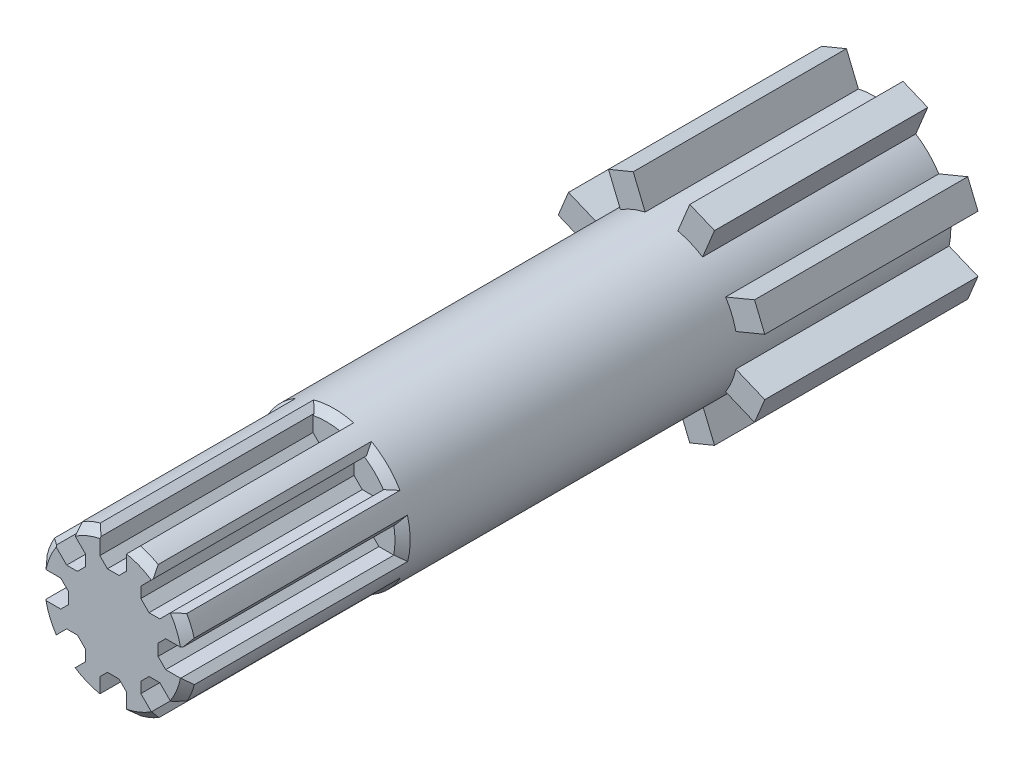
from build123d import *

# Parameters (mm, degrees)
SKETCH3_R           = 2.5
BOSS_EXTRUDE1_DEPTH = 25
BOSS_EXTRUDE2_DEPTH = 7
CUT_EXTRUDE1_START  = -7
CUT_EXTRUDE1_DEPTH  = 7
CHAMFER1_SIZE       = 0.25
CHAMFER2_SIZE       = 0.25
CHAMFER2_SIZE_2     = 0.215444776


with BuildPart() as part:
    # Sketch3 → Boss-Extrude1 (new body)
    with BuildSketch(Plane.XY):
        Circle(SKETCH3_R)
    extrude(amount=BOSS_EXTRUDE1_DEPTH)

    # Sketch2 → Boss-Extrude2 (add)
    with BuildSketch(Plane.XY):
        Polygon((1.741274388, 3.054032834), (1.128980896, 1.575825582), (0.315966908, 1.912587003), (0.928260399, 3.390794255), align=None)
        Polygon((3.390794255, 0.928260399), (1.912587003, 0.315966908), (1.575825582, 1.128980896), (3.054032834, 1.741274388), align=None)
        Polygon((3.054032834, -1.741274388), (1.575825582, -1.128980896), (1.912587003, -0.315966908), (3.390794255, -0.928260399), align=None)
        Polygon((0.928260399, -3.390794255), (0.315966908, -1.912587003), (1.128980896, -1.575825582), (1.741274388, -3.054032834), align=None)
        Polygon((-1.741274388, -3.054032834), (-1.128980896, -1.575825582), (-0.315966908, -1.912587003), (-0.928260399, -3.390794255), align=None)
        Polygon((-3.390794255, -0.928260399), (-1.912587003, -0.315966908), (-1.575825582, -1.128980896), (-3.054032834, -1.741274388), align=None)
        Polygon((-3.054032834, 1.741274388), (-1.575825582, 1.128980896), (-1.912587003, 0.315966908), (-3.390794255, 0.928260399), align=None)
        Polygon((-0.928260399, 3.390794255), (-0.315966908, 1.912587003), (-1.128980896, 1.575825582), (-1.741274388, 3.054032834), align=None)
    extrude(amount=BOSS_EXTRUDE2_DEPTH)

    # Sketch4 → Cut-Extrude1 (cut)
    with BuildSketch(Plane.XY.offset(25).offset(CUT_EXTRUDE1_START)):
        with BuildLine():
            Line((1.351900019, 0.729646051), (2.051299389, 1.429045422))
            ThreePointArc((2.051299389, 1.429045422), (1.767766953, 1.767766953), (1.429045422, 2.051299389))
            Line((1.429045422, 2.051299389), (0.729646051, 1.351900019))
            Line((0.729646051, 1.351900019), (1.351900019, 0.729646051))
        make_face()
        with BuildLine():
            Line((1.471875341, -0.44), (2.460975416, -0.44))
            ThreePointArc((2.460975416, -0.44), (2.5, 0), (2.460975416, 0.44))
            Line((2.460975416, 0.44), (1.471875341, 0.44))
            Line((1.471875341, 0.44), (1.471875341, -0.44))
        make_face()
        with BuildLine():
            Line((0.44, 1.471875341), (0.44, 2.460975416))
            ThreePointArc((0.44, 2.460975416), (0, 2.5), (-0.44, 2.460975416))
            Line((-0.44, 2.460975416), (-0.44, 1.471875341))
            Line((-0.44, 1.471875341), (0.44, 1.471875341))
        make_face()
        with BuildLine():
            Line((0.729646051, -1.351900019), (1.429045422, -2.051299389))
            ThreePointArc((1.429045422, -2.051299389), (1.767766953, -1.767766953), (2.051299389, -1.429045422))
            Line((2.051299389, -1.429045422), (1.351900019, -0.729646051))
            Line((1.351900019, -0.729646051), (0.729646051, -1.351900019))
        make_face()
        with BuildLine():
            Line((-0.44, -1.471875341), (-0.44, -2.460975416))
            ThreePointArc((-0.44, -2.460975416), (0, -2.5), (0.44, -2.460975416))
            Line((0.44, -2.460975416), (0.44, -1.471875341))
            Line((0.44, -1.471875341), (-0.44, -1.471875341))
        make_face()
        with BuildLine():
            Line((-1.351900019, -0.729646051), (-2.051299389, -1.429045422))
            ThreePointArc((-2.051299389, -1.429045422), (-1.767766953, -1.767766953), (-1.429045422, -2.051299389))
            Line((-1.429045422, -2.051299389), (-0.729646051, -1.351900019))
            Line((-0.729646051, -1.351900019), (-1.351900019, -0.729646051))
        make_face()
        with BuildLine():
            Line((-1.471875341, 0.44), (-2.460975416, 0.44))
            ThreePointArc((-2.460975416, 0.44), (-2.5, 0), (-2.460975416, -0.44))
            Line((-2.460975416, -0.44), (-1.471875341, -0.44))
            Line((-1.471875341, -0.44), (-1.471875341, 0.44))
        make_face()
        with BuildLine():
            Line((-0.729646051, 1.351900019), (-1.429045422, 2.051299389))
            ThreePointArc((-1.429045422, 2.051299389), (-1.767766953, 1.767766953), (-2.051299389, 1.429045422))
            Line((-2.051299389, 1.429045422), (-1.351900019, 0.729646051))
            Line((-1.351900019, 0.729646051), (-0.729646051, 1.351900019))
        make_face()
    extrude(amount=CUT_EXTRUDE1_DEPTH, mode=Mode.SUBTRACT)

    # Chamfer1
    chamfer1_edges = [part.edges().sort_by_distance(p)[0] for p in [
        (-0.729646051, 1.351900019, 21.5),
        (-1.351900019, 0.729646051, 21.5),
        (-1.471875341, 0.44, 21.5),
        (-1.471875341, -0.44, 21.5),
        (-1.351900019, -0.729646051, 21.5),
        (-0.729646051, -1.351900019, 21.5),
        (-0.44, -1.471875341, 21.5),
        (0.44, -1.471875341, 21.5),
        (0.729646051, -1.351900019, 21.5),
        (1.351900019, -0.729646051, 21.5),
        (1.471875341, -0.44, 21.5),
        (1.471875341, 0.44, 21.5),
        (1.351900019, 0.729646051, 21.5),
        (0.729646051, 1.351900019, 21.5),
        (0.44, 1.471875341, 21.5),
        (-0.44, 1.471875341, 21.5),
    ]]
    chamfer(chamfer1_edges, length=CHAMFER1_SIZE)

    # Chamfer2
    # the kernel refuses this chamfer: 0.25, 0.215444776 mm, written as the material it takes off along each edge
    with BuildSketch(Plane(origin=(0, 0, 25), x_dir=(0.7615184846341085, 0.6481431921732813, 0), z_dir=(0.6481431921732813, -0.7615184846341085, 0))) as chamfer2_piece_1:
        Polygon((2.5, -CHAMFER2_SIZE), (2.5 - CHAMFER2_SIZE, 0), (2.5, 0), align=None)
    revolve(axis=Axis((0, 0, 25), (0, 0, 1)), revolution_arc=54.196495253, mode=Mode.SUBTRACT)
    with BuildSketch(Plane(origin=(0, 0, 25), x_dir=(0.08016843811805723, 0.9967813308493048, 0), z_dir=(0.9967813308493048, -0.08016843811805723, 0))) as chamfer2_piece_2:
        Polygon((2.5, -CHAMFER2_SIZE), (2.5 - CHAMFER2_SIZE, 0), (2.5, 0), align=None)
    revolve(axis=Axis((0, 0, 25), (0, 0, 1)), revolution_arc=54.196495253, mode=Mode.SUBTRACT)
    with BuildSketch(Plane(origin=(0, 0, 25), x_dir=(-0.6481431921732823, 0.7615184846341077, 0), z_dir=(0.7615184846341077, 0.6481431921732823, 0))) as chamfer2_piece_3:
        Polygon((2.5, -CHAMFER2_SIZE), (2.5 - CHAMFER2_SIZE, 0), (2.5, 0), align=None)
    revolve(axis=Axis((0, 0, 25), (0, 0, 1)), revolution_arc=54.196495253, mode=Mode.SUBTRACT)
    with BuildSketch(Plane(origin=(0, 0, 25), x_dir=(-0.9967813308493041, 0.08016843811806748, 0), z_dir=(0.08016843811806748, 0.9967813308493041, 0))) as chamfer2_piece_4:
        Polygon((2.5, -CHAMFER2_SIZE), (2.5 - CHAMFER2_SIZE, 0), (2.5, 0), align=None)
    revolve(axis=Axis((0, 0, 25), (0, 0, 1)), revolution_arc=54.196495253, mode=Mode.SUBTRACT)
    with BuildSketch(Plane(origin=(0, 0, 25), x_dir=(-0.7615184846341134, -0.6481431921732754, 0), z_dir=(-0.6481431921732754, 0.7615184846341134, 0))) as chamfer2_piece_5:
        Polygon((2.5, -CHAMFER2_SIZE), (2.5 - CHAMFER2_SIZE, 0), (2.5, 0), align=None)
    revolve(axis=Axis((0, 0, 25), (0, 0, 1)), revolution_arc=54.196495253, mode=Mode.SUBTRACT)
    with BuildSketch(Plane(origin=(0, 0, 25), x_dir=(-0.08016843811806489, -0.9967813308493042, 0), z_dir=(-0.9967813308493042, 0.08016843811806489, 0))) as chamfer2_piece_6:
        Polygon((2.5, -CHAMFER2_SIZE), (2.5 - CHAMFER2_SIZE, 0), (2.5, 0), align=None)
    revolve(axis=Axis((0, 0, 25), (0, 0, 1)), revolution_arc=54.196495253, mode=Mode.SUBTRACT)
    with BuildSketch(Plane(origin=(0, 0, 25), x_dir=(0.6481431921732781, -0.7615184846341112, 0), z_dir=(-0.7615184846341112, -0.6481431921732781, 0))) as chamfer2_piece_7:
        Polygon((2.5, -CHAMFER2_SIZE), (2.5 - CHAMFER2_SIZE, 0), (2.5, 0), align=None)
    revolve(axis=Axis((0, 0, 25), (0, 0, 1)), revolution_arc=54.196495253, mode=Mode.SUBTRACT)
    with BuildSketch(Plane(origin=(0, 0, 18), x_dir=(-0.34412160352675203, 0.938925088591298, 0), z_dir=(0.938925088591298, 0.34412160352675203, 0))) as chamfer2_piece_8_section:
        Polygon((2.5, -CHAMFER2_SIZE), (2.5 - CHAMFER2_SIZE, 0), (2.5, 0), align=None)
    chamfer2_piece_8 = revolve(axis=Axis((0, 0, 18), (0, 0, 1)), revolution_arc=49.743631183, mode=Mode.PRIVATE)
    chamfer2_piece_8 = split(chamfer2_piece_8, bisect_by=Plane(origin=(-0.311126984, -0.311126984, 18), z_dir=(0.7071067811865451, 0.7071067811865499, 0)), keep=Keep.TOP, mode=Mode.PRIVATE)
    chamfer2_piece_8 = split(chamfer2_piece_8, bisect_by=Plane(origin=(0.311126984, 0.311126984, 18), z_dir=(-0.7071067811865446, -0.7071067811865505, 0)), keep=Keep.TOP, mode=Mode.PRIVATE)
    add(chamfer2_piece_8, mode=Mode.SUBTRACT)
    with BuildSketch(Plane(origin=(-2.051299389, 1.429045422, 18), x_dir=(-0.5317673689079134, -0.8468904683397701, 0), z_dir=(0, 0, 1)), Plane(origin=(-2.460975416, -0.44, 18), x_dir=(0.22282568051677323, -0.97485830565382, 0), z_dir=(0, 0, 1)), Plane(origin=(-1.429045422, -2.051299389, 18), x_dir=(0.8468904683397623, -0.5317673689079256, 0), z_dir=(0, 0, 1)), Plane(origin=(0.44, -2.460975416, 18), x_dir=(0.9748583056538195, 0.22282568051677598, 0), z_dir=(0, 0, 1)), Plane(origin=(2.051299389, -1.429045422, 18), x_dir=(0.5317673689079216, 0.8468904683397649, 0), z_dir=(0, 0, 1)), Plane(origin=(1.429045422, 2.051299389, 18), x_dir=(-0.8468904683397676, 0.5317673689079173, 0), z_dir=(0, 0, 1)), Plane(origin=(-0.44, 2.460975416, 18), x_dir=(-0.9748583056538175, -0.22282568051678414, 0), z_dir=(0, 0, 1))) as chamfer2_piece_9:
        with BuildLine():
            Line((0.238861735, 0), (CHAMFER2_SIZE_2 * 0.222825680958, CHAMFER2_SIZE_2 * 0.974858307584))
            Line((CHAMFER2_SIZE_2 * 0.222825680958, CHAMFER2_SIZE_2 * 0.974858307584), (0, 0))
            ThreePointArc((0, 0), (0.122792323, -0.002852116), (0.238861735, 0))
        make_face()
    extrude(amount=7.614246036, mode=Mode.SUBTRACT)
    with BuildSketch(Plane(origin=(-1.429045422, 2.051299389, 18), x_dir=(0.8437513575613513, 0.5367342420727197, 0), z_dir=(0, 0, 1)), Plane(origin=(-2.460975416, 0.44, 18), x_dir=(0.21709388430235488, 0.9761507288316266, 0), z_dir=(0, 0, 1)), Plane(origin=(-2.051299389, -1.429045422, 18), x_dir=(-0.5367342420727129, 0.8437513575613556, 0), z_dir=(0, 0, 1)), Plane(origin=(-0.44, -2.460975416, 18), x_dir=(-0.976150728831628, 0.21709388430234888, 0), z_dir=(0, 0, 1)), Plane(origin=(1.429045422, -2.051299389, 18), x_dir=(-0.8437513575613538, -0.5367342420727156, 0), z_dir=(0, 0, 1)), Plane(origin=(2.460975416, -0.44, 18), x_dir=(-0.2170938843023468, -0.9761507288316283, 0), z_dir=(0, 0, 1)), Plane(origin=(2.051299389, 1.429045422, 18), x_dir=(0.5367342420727192, -0.8437513575613516, 0), z_dir=(0, 0, 1)), Plane(origin=(0.44, 2.460975416, 18), x_dir=(0.9761507288316289, -0.2170938843023443, 0), z_dir=(0, 0, 1))) as chamfer2_piece_10:
        with BuildLine():
            Line((0.209512783, 0), (CHAMFER2_SIZE * 0.217093884302, -CHAMFER2_SIZE * 0.976150728832))
            Line((CHAMFER2_SIZE * 0.217093884302, -CHAMFER2_SIZE * 0.976150728832), (0, 0))
            ThreePointArc((0, 0), (0.107437891, 0.002194306), (0.209512783, 0))
        make_face()
    extrude(amount=7.642920747, mode=Mode.SUBTRACT)
    with BuildSketch(Plane(origin=(0, 0, 18), x_dir=(-0.9072510165756378, 0.42058957776254, 0), z_dir=(0.42058957776254, 0.9072510165756378, 0))) as chamfer2_piece_11_section:
        Polygon((2.5, -CHAMFER2_SIZE), (2.5 - CHAMFER2_SIZE, 0), (2.5, 0), align=None)
    chamfer2_piece_11 = revolve(axis=Axis((0, 0, 18), (0, 0, 1)), revolution_arc=49.743631183, mode=Mode.PRIVATE)
    chamfer2_piece_11 = split(chamfer2_piece_11, bisect_by=Plane(origin=(0, -0.44, 18), z_dir=(0, 1, 0)), keep=Keep.TOP, mode=Mode.PRIVATE)
    chamfer2_piece_11 = split(chamfer2_piece_11, bisect_by=Plane(origin=(0, 0.44, 18), z_dir=(0, -1, 0)), keep=Keep.TOP, mode=Mode.PRIVATE)
    add(chamfer2_piece_11, mode=Mode.SUBTRACT)
    with BuildSketch(Plane(origin=(0, 0, 18), x_dir=(-0.9389250885913029, -0.34412160352673893, 0), z_dir=(-0.34412160352673893, 0.9389250885913029, 0))) as chamfer2_piece_12_section:
        Polygon((2.5, -CHAMFER2_SIZE), (2.5 - CHAMFER2_SIZE, 0), (2.5, 0), align=None)
    chamfer2_piece_12 = revolve(axis=Axis((0, 0, 18), (0, 0, 1)), revolution_arc=49.743631183, mode=Mode.PRIVATE)
    chamfer2_piece_12 = split(chamfer2_piece_12, bisect_by=Plane(origin=(0.311126984, -0.311126984, 18), z_dir=(-0.7071067811865349, 0.7071067811865602, 0)), keep=Keep.TOP, mode=Mode.PRIVATE)
    chamfer2_piece_12 = split(chamfer2_piece_12, bisect_by=Plane(origin=(-0.311126984, 0.311126984, 18), z_dir=(0.7071067811865352, -0.7071067811865598, 0)), keep=Keep.TOP, mode=Mode.PRIVATE)
    add(chamfer2_piece_12, mode=Mode.SUBTRACT)
    with BuildSketch(Plane(origin=(0, 0, 18), x_dir=(-0.42058957776253453, -0.9072510165756403, 0), z_dir=(-0.9072510165756403, 0.42058957776253453, 0))) as chamfer2_piece_13_section:
        Polygon((2.5, -CHAMFER2_SIZE), (2.5 - CHAMFER2_SIZE, 0), (2.5, 0), align=None)
    chamfer2_piece_13 = revolve(axis=Axis((0, 0, 18), (0, 0, 1)), revolution_arc=49.743631183, mode=Mode.PRIVATE)
    chamfer2_piece_13 = split(chamfer2_piece_13, bisect_by=Plane(origin=(0.44, 0, 18), z_dir=(-1, 0, 0)), keep=Keep.TOP, mode=Mode.PRIVATE)
    chamfer2_piece_13 = split(chamfer2_piece_13, bisect_by=Plane(origin=(-0.44, 0, 18), z_dir=(1, 0, 0)), keep=Keep.TOP, mode=Mode.PRIVATE)
    add(chamfer2_piece_13, mode=Mode.SUBTRACT)
    with BuildSketch(Plane(origin=(0, 0, 18), x_dir=(0.3441216035267472, -0.9389250885912998, 0), z_dir=(-0.9389250885912998, -0.3441216035267472, 0))) as chamfer2_piece_14_section:
        Polygon((2.5, -CHAMFER2_SIZE), (2.5 - CHAMFER2_SIZE, 0), (2.5, 0), align=None)
    chamfer2_piece_14 = revolve(axis=Axis((0, 0, 18), (0, 0, 1)), revolution_arc=49.743631183, mode=Mode.PRIVATE)
    chamfer2_piece_14 = split(chamfer2_piece_14, bisect_by=Plane(origin=(0.311126984, 0.311126984, 18), z_dir=(-0.7071067811865541, -0.707106781186541, 0)), keep=Keep.TOP, mode=Mode.PRIVATE)
    chamfer2_piece_14 = split(chamfer2_piece_14, bisect_by=Plane(origin=(-0.311126984, -0.311126984, 18), z_dir=(0.7071067811865537, 0.7071067811865414, 0)), keep=Keep.TOP, mode=Mode.PRIVATE)
    add(chamfer2_piece_14, mode=Mode.SUBTRACT)
    with BuildSketch(Plane(origin=(0, 0, 18), x_dir=(0.9072526697295138, -0.4205860117368026, 0), z_dir=(-0.4205860117368026, -0.9072526697295138, 0))) as chamfer2_piece_15_section:
        Polygon((2.5 - CHAMFER2_SIZE, 0), (2.5, -CHAMFER2_SIZE), (2.5, 0), align=None)
    chamfer2_piece_15 = revolve(axis=Axis((0, 0, 18), (0, 0, 1)), revolution_arc=24.871590386, mode=Mode.PRIVATE)
    chamfer2_piece_15 = split(chamfer2_piece_15, bisect_by=Plane(origin=(0, -0.44, 18), z_dir=(0, 1, 0)), keep=Keep.TOP, mode=Mode.PRIVATE)
    add(chamfer2_piece_15, mode=Mode.SUBTRACT)
    with BuildSketch(Plane(origin=(2.460975416, 0.44, 18), x_dir=(-1, 0, 0), z_dir=(0, 0, 1))) as chamfer2_piece_16:
        with BuildLine():
            Line((CHAMFER2_SIZE_2 * 1.00000000198, 0), (0.053224529, -0.232856346))
            ThreePointArc((0.053224529, -0.232856346), (0.024580874, -0.120340641), (0, 0))
            Line((0, 0), (CHAMFER2_SIZE_2 * 1.00000000198, 0))
        make_face()
    extrude(amount=7.614246036, mode=Mode.SUBTRACT)
    with BuildSketch(Plane(origin=(0, 0, 18), x_dir=(0.9389250885912971, 0.34412160352675497, 0), z_dir=(0.34412160352675497, -0.9389250885912971, 0))) as chamfer2_piece_17_section:
        Polygon((2.5, -CHAMFER2_SIZE), (2.5 - CHAMFER2_SIZE, 0), (2.5, 0), align=None)
    chamfer2_piece_17 = revolve(axis=Axis((0, 0, 18), (0, 0, 1)), revolution_arc=49.743631183, mode=Mode.PRIVATE)
    chamfer2_piece_17 = split(chamfer2_piece_17, bisect_by=Plane(origin=(-0.311126984, 0.311126984, 18), z_dir=(0.7071067811865476, -0.7071067811865475, 0)), keep=Keep.TOP, mode=Mode.PRIVATE)
    chamfer2_piece_17 = split(chamfer2_piece_17, bisect_by=Plane(origin=(0.311126984, -0.311126984, 18), z_dir=(-0.7071067811865478, 0.7071067811865474, 0)), keep=Keep.TOP, mode=Mode.PRIVATE)
    add(chamfer2_piece_17, mode=Mode.SUBTRACT)
    with BuildSketch(Plane(origin=(0, 0, 18), x_dir=(0.4205895777625337, 0.9072510165756408, 0), z_dir=(0.9072510165756408, -0.4205895777625337, 0))) as chamfer2_piece_18_section:
        Polygon((2.5, -CHAMFER2_SIZE), (2.5 - CHAMFER2_SIZE, 0), (2.5, 0), align=None)
    chamfer2_piece_18 = revolve(axis=Axis((0, 0, 18), (0, 0, 1)), revolution_arc=49.743631183, mode=Mode.PRIVATE)
    chamfer2_piece_18 = split(chamfer2_piece_18, bisect_by=Plane(origin=(-0.44, 0, 18), z_dir=(1, 0, 0)), keep=Keep.TOP, mode=Mode.PRIVATE)
    chamfer2_piece_18 = split(chamfer2_piece_18, bisect_by=Plane(origin=(0.44, 0, 18), z_dir=(-1, 0, 0)), keep=Keep.TOP, mode=Mode.PRIVATE)
    add(chamfer2_piece_18, mode=Mode.SUBTRACT)
    with BuildSketch(Plane(origin=(0, 0, 25), x_dir=(0.9967813308493045, -0.08016843811806099, 0), z_dir=(-0.08016843811806099, -0.9967813308493045, 0))) as chamfer2_piece_19:
        Polygon((2.5, -CHAMFER2_SIZE), (2.5 - CHAMFER2_SIZE, 0), (2.5, 0), align=None)
    revolve(axis=Axis((0, 0, 25), (0, 0, 1)), revolution_arc=54.196495253, mode=Mode.SUBTRACT)
    with BuildSketch(Plane(origin=(0, 0, 18), x_dir=(1, 0, 0), z_dir=(0, -1, 0))) as chamfer2_piece_20_section:
        Polygon((2.5 - CHAMFER2_SIZE, 0), (2.5, -CHAMFER2_SIZE), (2.5, 0), align=None)
    chamfer2_piece_20 = revolve(axis=Axis((0, 0, 18), (0, 0, 1)), revolution_arc=24.871590386, mode=Mode.PRIVATE)
    chamfer2_piece_20 = split(chamfer2_piece_20, bisect_by=Plane(origin=(0, 0.44, 18), z_dir=(0, -1, 0)), keep=Keep.TOP, mode=Mode.PRIVATE)
    add(chamfer2_piece_20, mode=Mode.SUBTRACT)
    with BuildSketch(Plane(origin=(0, 0, 18), x_dir=(-0.34412160352675203, 0.938925088591298, 0), z_dir=(0.938925088591298, 0.34412160352675203, 0))) as chamfer2_piece_21a_section:
        Polygon((2.5, -CHAMFER2_SIZE), (2.5 - CHAMFER2_SIZE, 0), (2.5, 0), align=None)
    chamfer2_piece_21a = revolve(axis=Axis((0, 0, 18), (0, 0, 1)), revolution_arc=49.743631183, mode=Mode.PRIVATE)
    chamfer2_piece_21a = split(chamfer2_piece_21a, bisect_by=Plane(origin=(0.311126984, 0.311126984, 18), z_dir=(0.7071067811865446, 0.7071067811865505, 0)), keep=Keep.TOP, mode=Mode.PRIVATE)
    with BuildSketch(Plane(origin=(-1.429045422, 2.051299389, 17.357079253), x_dir=(0.8437513575613513, 0.5367342420727197, 0), z_dir=(0, 0, 1))) as chamfer2_piece_21b_section:
        with BuildLine():
            Line((0.209512783, 0), (CHAMFER2_SIZE * 0.217093884302, -CHAMFER2_SIZE * 0.976150728832))
            Line((CHAMFER2_SIZE * 0.217093884302, -CHAMFER2_SIZE * 0.976150728832), (0, 0))
            ThreePointArc((0, 0), (0.107437891, 0.002194306), (0.209512783, 0))
        make_face()
    chamfer2_piece_21b = extrude(amount=7.642920747, mode=Mode.PRIVATE)
    chamfer2_piece_21b = split(chamfer2_piece_21b, bisect_by=Plane(origin=(-1.429045422, 2.051299389, 18), z_dir=(0, 0, -1)), keep=Keep.TOP, mode=Mode.PRIVATE)
    chamfer2_piece_21 = chamfer2_piece_21a & chamfer2_piece_21b
    add(chamfer2_piece_21, mode=Mode.SUBTRACT)
    with BuildSketch(Plane(origin=(-2.051299389, 1.429045422, 17.385753964), x_dir=(-0.5317673689079134, -0.8468904683397701, 0), z_dir=(0, 0, 1))) as chamfer2_piece_22a_section:
        with BuildLine():
            Line((0.238861735, 0), (CHAMFER2_SIZE_2 * 0.222825680958, CHAMFER2_SIZE_2 * 0.974858307584))
            Line((CHAMFER2_SIZE_2 * 0.222825680958, CHAMFER2_SIZE_2 * 0.974858307584), (0, 0))
            ThreePointArc((0, 0), (0.122792323, -0.002852116), (0.238861735, 0))
        make_face()
    chamfer2_piece_22a = extrude(amount=7.614246036, mode=Mode.PRIVATE)
    chamfer2_piece_22a = split(chamfer2_piece_22a, bisect_by=Plane(origin=(-2.051299389, 1.429045422, 18), z_dir=(0, 0, -1)), keep=Keep.TOP, mode=Mode.PRIVATE)
    with BuildSketch(Plane(origin=(0, 0, 18), x_dir=(-0.34412160352675203, 0.938925088591298, 0), z_dir=(0.938925088591298, 0.34412160352675203, 0))) as chamfer2_piece_22b_section:
        Polygon((2.5, -CHAMFER2_SIZE), (2.5 - CHAMFER2_SIZE, 0), (2.5, 0), align=None)
    chamfer2_piece_22b = revolve(axis=Axis((0, 0, 18), (0, 0, 1)), revolution_arc=49.743631183, mode=Mode.PRIVATE)
    chamfer2_piece_22b = split(chamfer2_piece_22b, bisect_by=Plane(origin=(-0.311126984, -0.311126984, 18), z_dir=(-0.7071067811865451, -0.7071067811865499, 0)), keep=Keep.TOP, mode=Mode.PRIVATE)
    chamfer2_piece_22 = chamfer2_piece_22a & chamfer2_piece_22b
    add(chamfer2_piece_22, mode=Mode.SUBTRACT)
    with BuildSketch(Plane(origin=(0, 0, 18), x_dir=(-0.9072510165756378, 0.42058957776254, 0), z_dir=(0.42058957776254, 0.9072510165756378, 0))) as chamfer2_piece_23a_section:
        Polygon((2.5, -CHAMFER2_SIZE), (2.5 - CHAMFER2_SIZE, 0), (2.5, 0), align=None)
    chamfer2_piece_23a = revolve(axis=Axis((0, 0, 18), (0, 0, 1)), revolution_arc=49.743631183, mode=Mode.PRIVATE)
    chamfer2_piece_23a = split(chamfer2_piece_23a, bisect_by=Plane(origin=(0, 0.44, 18), z_dir=(0, 1, 0)), keep=Keep.TOP, mode=Mode.PRIVATE)
    with BuildSketch(Plane(origin=(-2.460975416, 0.44, 17.357079253), x_dir=(0.21709388430235488, 0.9761507288316266, 0), z_dir=(0, 0, 1))) as chamfer2_piece_23b_section:
        with BuildLine():
            Line((0.209512783, 0), (CHAMFER2_SIZE * 0.217093884302, -CHAMFER2_SIZE * 0.976150728832))
            Line((CHAMFER2_SIZE * 0.217093884302, -CHAMFER2_SIZE * 0.976150728832), (0, 0))
            ThreePointArc((0, 0), (0.107437891, 0.002194306), (0.209512783, 0))
        make_face()
    chamfer2_piece_23b = extrude(amount=7.642920747, mode=Mode.PRIVATE)
    chamfer2_piece_23b = split(chamfer2_piece_23b, bisect_by=Plane(origin=(-2.460975416, 0.44, 18), z_dir=(0, 0, -1)), keep=Keep.TOP, mode=Mode.PRIVATE)
    chamfer2_piece_23 = chamfer2_piece_23a & chamfer2_piece_23b
    add(chamfer2_piece_23, mode=Mode.SUBTRACT)
    with BuildSketch(Plane(origin=(-2.460975416, -0.44, 17.385753964), x_dir=(0.22282568051677323, -0.97485830565382, 0), z_dir=(0, 0, 1))) as chamfer2_piece_24a_section:
        with BuildLine():
            Line((0.238861735, 0), (CHAMFER2_SIZE_2 * 0.222825680958, CHAMFER2_SIZE_2 * 0.974858307584))
            Line((CHAMFER2_SIZE_2 * 0.222825680958, CHAMFER2_SIZE_2 * 0.974858307584), (0, 0))
            ThreePointArc((0, 0), (0.122792323, -0.002852116), (0.238861735, 0))
        make_face()
    chamfer2_piece_24a = extrude(amount=7.614246036, mode=Mode.PRIVATE)
    chamfer2_piece_24a = split(chamfer2_piece_24a, bisect_by=Plane(origin=(-2.460975416, -0.44, 18), z_dir=(0, 0, -1)), keep=Keep.TOP, mode=Mode.PRIVATE)
    with BuildSketch(Plane(origin=(0, 0, 18), x_dir=(-0.9072510165756378, 0.42058957776254, 0), z_dir=(0.42058957776254, 0.9072510165756378, 0))) as chamfer2_piece_24b_section:
        Polygon((2.5, -CHAMFER2_SIZE), (2.5 - CHAMFER2_SIZE, 0), (2.5, 0), align=None)
    chamfer2_piece_24b = revolve(axis=Axis((0, 0, 18), (0, 0, 1)), revolution_arc=49.743631183, mode=Mode.PRIVATE)
    chamfer2_piece_24b = split(chamfer2_piece_24b, bisect_by=Plane(origin=(0, -0.44, 18), z_dir=(0, -1, 0)), keep=Keep.TOP, mode=Mode.PRIVATE)
    chamfer2_piece_24 = chamfer2_piece_24a & chamfer2_piece_24b
    add(chamfer2_piece_24, mode=Mode.SUBTRACT)
    with BuildSketch(Plane(origin=(0, 0, 18), x_dir=(-0.9389250885913029, -0.34412160352673893, 0), z_dir=(-0.34412160352673893, 0.9389250885913029, 0))) as chamfer2_piece_25a_section:
        Polygon((2.5, -CHAMFER2_SIZE), (2.5 - CHAMFER2_SIZE, 0), (2.5, 0), align=None)
    chamfer2_piece_25a = revolve(axis=Axis((0, 0, 18), (0, 0, 1)), revolution_arc=49.743631183, mode=Mode.PRIVATE)
    chamfer2_piece_25a = split(chamfer2_piece_25a, bisect_by=Plane(origin=(-0.311126984, 0.311126984, 18), z_dir=(-0.7071067811865352, 0.7071067811865598, 0)), keep=Keep.TOP, mode=Mode.PRIVATE)
    with BuildSketch(Plane(origin=(-2.051299389, -1.429045422, 17.357079253), x_dir=(-0.5367342420727129, 0.8437513575613556, 0), z_dir=(0, 0, 1))) as chamfer2_piece_25b_section:
        with BuildLine():
            Line((0.209512783, 0), (CHAMFER2_SIZE * 0.217093884302, -CHAMFER2_SIZE * 0.976150728832))
            Line((CHAMFER2_SIZE * 0.217093884302, -CHAMFER2_SIZE * 0.976150728832), (0, 0))
            ThreePointArc((0, 0), (0.107437891, 0.002194306), (0.209512783, 0))
        make_face()
    chamfer2_piece_25b = extrude(amount=7.642920747, mode=Mode.PRIVATE)
    chamfer2_piece_25b = split(chamfer2_piece_25b, bisect_by=Plane(origin=(-2.051299389, -1.429045422, 18), z_dir=(0, 0, -1)), keep=Keep.TOP, mode=Mode.PRIVATE)
    chamfer2_piece_25 = chamfer2_piece_25a & chamfer2_piece_25b
    add(chamfer2_piece_25, mode=Mode.SUBTRACT)
    with BuildSketch(Plane(origin=(-1.429045422, -2.051299389, 17.385753964), x_dir=(0.8468904683397623, -0.5317673689079256, 0), z_dir=(0, 0, 1))) as chamfer2_piece_26a_section:
        with BuildLine():
            Line((0.238861735, 0), (CHAMFER2_SIZE_2 * 0.222825680958, CHAMFER2_SIZE_2 * 0.974858307584))
            Line((CHAMFER2_SIZE_2 * 0.222825680958, CHAMFER2_SIZE_2 * 0.974858307584), (0, 0))
            ThreePointArc((0, 0), (0.122792323, -0.002852116), (0.238861735, 0))
        make_face()
    chamfer2_piece_26a = extrude(amount=7.614246036, mode=Mode.PRIVATE)
    chamfer2_piece_26a = split(chamfer2_piece_26a, bisect_by=Plane(origin=(-1.429045422, -2.051299389, 18), z_dir=(0, 0, -1)), keep=Keep.TOP, mode=Mode.PRIVATE)
    with BuildSketch(Plane(origin=(0, 0, 18), x_dir=(-0.9389250885913029, -0.34412160352673893, 0), z_dir=(-0.34412160352673893, 0.9389250885913029, 0))) as chamfer2_piece_26b_section:
        Polygon((2.5, -CHAMFER2_SIZE), (2.5 - CHAMFER2_SIZE, 0), (2.5, 0), align=None)
    chamfer2_piece_26b = revolve(axis=Axis((0, 0, 18), (0, 0, 1)), revolution_arc=49.743631183, mode=Mode.PRIVATE)
    chamfer2_piece_26b = split(chamfer2_piece_26b, bisect_by=Plane(origin=(0.311126984, -0.311126984, 18), z_dir=(0.7071067811865349, -0.7071067811865602, 0)), keep=Keep.TOP, mode=Mode.PRIVATE)
    chamfer2_piece_26 = chamfer2_piece_26a & chamfer2_piece_26b
    add(chamfer2_piece_26, mode=Mode.SUBTRACT)
    with BuildSketch(Plane(origin=(0, 0, 18), x_dir=(-0.42058957776253453, -0.9072510165756403, 0), z_dir=(-0.9072510165756403, 0.42058957776253453, 0))) as chamfer2_piece_27a_section:
        Polygon((2.5, -CHAMFER2_SIZE), (2.5 - CHAMFER2_SIZE, 0), (2.5, 0), align=None)
    chamfer2_piece_27a = revolve(axis=Axis((0, 0, 18), (0, 0, 1)), revolution_arc=49.743631183, mode=Mode.PRIVATE)
    chamfer2_piece_27a = split(chamfer2_piece_27a, bisect_by=Plane(origin=(-0.44, 0, 18), z_dir=(-1, 0, 0)), keep=Keep.TOP, mode=Mode.PRIVATE)
    with BuildSketch(Plane(origin=(-0.44, -2.460975416, 17.357079253), x_dir=(-0.976150728831628, 0.21709388430234888, 0), z_dir=(0, 0, 1))) as chamfer2_piece_27b_section:
        with BuildLine():
            Line((0.209512783, 0), (CHAMFER2_SIZE * 0.217093884302, -CHAMFER2_SIZE * 0.976150728832))
            Line((CHAMFER2_SIZE * 0.217093884302, -CHAMFER2_SIZE * 0.976150728832), (0, 0))
            ThreePointArc((0, 0), (0.107437891, 0.002194306), (0.209512783, 0))
        make_face()
    chamfer2_piece_27b = extrude(amount=7.642920747, mode=Mode.PRIVATE)
    chamfer2_piece_27b = split(chamfer2_piece_27b, bisect_by=Plane(origin=(-0.44, -2.460975416, 18), z_dir=(0, 0, -1)), keep=Keep.TOP, mode=Mode.PRIVATE)
    chamfer2_piece_27 = chamfer2_piece_27a & chamfer2_piece_27b
    add(chamfer2_piece_27, mode=Mode.SUBTRACT)
    with BuildSketch(Plane(origin=(0.44, -2.460975416, 17.385753964), x_dir=(0.9748583056538195, 0.22282568051677598, 0), z_dir=(0, 0, 1))) as chamfer2_piece_28a_section:
        with BuildLine():
            Line((0.238861735, 0), (CHAMFER2_SIZE_2 * 0.222825680958, CHAMFER2_SIZE_2 * 0.974858307584))
            Line((CHAMFER2_SIZE_2 * 0.222825680958, CHAMFER2_SIZE_2 * 0.974858307584), (0, 0))
            ThreePointArc((0, 0), (0.122792323, -0.002852116), (0.238861735, 0))
        make_face()
    chamfer2_piece_28a = extrude(amount=7.614246036, mode=Mode.PRIVATE)
    chamfer2_piece_28a = split(chamfer2_piece_28a, bisect_by=Plane(origin=(0.44, -2.460975416, 18), z_dir=(0, 0, -1)), keep=Keep.TOP, mode=Mode.PRIVATE)
    with BuildSketch(Plane(origin=(0, 0, 18), x_dir=(-0.42058957776253453, -0.9072510165756403, 0), z_dir=(-0.9072510165756403, 0.42058957776253453, 0))) as chamfer2_piece_28b_section:
        Polygon((2.5, -CHAMFER2_SIZE), (2.5 - CHAMFER2_SIZE, 0), (2.5, 0), align=None)
    chamfer2_piece_28b = revolve(axis=Axis((0, 0, 18), (0, 0, 1)), revolution_arc=49.743631183, mode=Mode.PRIVATE)
    chamfer2_piece_28b = split(chamfer2_piece_28b, bisect_by=Plane(origin=(0.44, 0, 18), z_dir=(1, 0, 0)), keep=Keep.TOP, mode=Mode.PRIVATE)
    chamfer2_piece_28 = chamfer2_piece_28a & chamfer2_piece_28b
    add(chamfer2_piece_28, mode=Mode.SUBTRACT)
    with BuildSketch(Plane(origin=(0, 0, 18), x_dir=(0.3441216035267472, -0.9389250885912998, 0), z_dir=(-0.9389250885912998, -0.3441216035267472, 0))) as chamfer2_piece_29a_section:
        Polygon((2.5, -CHAMFER2_SIZE), (2.5 - CHAMFER2_SIZE, 0), (2.5, 0), align=None)
    chamfer2_piece_29a = revolve(axis=Axis((0, 0, 18), (0, 0, 1)), revolution_arc=49.743631183, mode=Mode.PRIVATE)
    chamfer2_piece_29a = split(chamfer2_piece_29a, bisect_by=Plane(origin=(-0.311126984, -0.311126984, 18), z_dir=(-0.7071067811865537, -0.7071067811865414, 0)), keep=Keep.TOP, mode=Mode.PRIVATE)
    with BuildSketch(Plane(origin=(1.429045422, -2.051299389, 17.357079253), x_dir=(-0.8437513575613538, -0.5367342420727156, 0), z_dir=(0, 0, 1))) as chamfer2_piece_29b_section:
        with BuildLine():
            Line((0.209512783, 0), (CHAMFER2_SIZE * 0.217093884302, -CHAMFER2_SIZE * 0.976150728832))
            Line((CHAMFER2_SIZE * 0.217093884302, -CHAMFER2_SIZE * 0.976150728832), (0, 0))
            ThreePointArc((0, 0), (0.107437891, 0.002194306), (0.209512783, 0))
        make_face()
    chamfer2_piece_29b = extrude(amount=7.642920747, mode=Mode.PRIVATE)
    chamfer2_piece_29b = split(chamfer2_piece_29b, bisect_by=Plane(origin=(1.429045422, -2.051299389, 18), z_dir=(0, 0, -1)), keep=Keep.TOP, mode=Mode.PRIVATE)
    chamfer2_piece_29 = chamfer2_piece_29a & chamfer2_piece_29b
    add(chamfer2_piece_29, mode=Mode.SUBTRACT)
    with BuildSketch(Plane(origin=(2.051299389, -1.429045422, 17.385753964), x_dir=(0.5317673689079216, 0.8468904683397649, 0), z_dir=(0, 0, 1))) as chamfer2_piece_30a_section:
        with BuildLine():
            Line((0.238861735, 0), (CHAMFER2_SIZE_2 * 0.222825680958, CHAMFER2_SIZE_2 * 0.974858307584))
            Line((CHAMFER2_SIZE_2 * 0.222825680958, CHAMFER2_SIZE_2 * 0.974858307584), (0, 0))
            ThreePointArc((0, 0), (0.122792323, -0.002852116), (0.238861735, 0))
        make_face()
    chamfer2_piece_30a = extrude(amount=7.614246036, mode=Mode.PRIVATE)
    chamfer2_piece_30a = split(chamfer2_piece_30a, bisect_by=Plane(origin=(2.051299389, -1.429045422, 18), z_dir=(0, 0, -1)), keep=Keep.TOP, mode=Mode.PRIVATE)
    with BuildSketch(Plane(origin=(0, 0, 18), x_dir=(0.3441216035267472, -0.9389250885912998, 0), z_dir=(-0.9389250885912998, -0.3441216035267472, 0))) as chamfer2_piece_30b_section:
        Polygon((2.5, -CHAMFER2_SIZE), (2.5 - CHAMFER2_SIZE, 0), (2.5, 0), align=None)
    chamfer2_piece_30b = revolve(axis=Axis((0, 0, 18), (0, 0, 1)), revolution_arc=49.743631183, mode=Mode.PRIVATE)
    chamfer2_piece_30b = split(chamfer2_piece_30b, bisect_by=Plane(origin=(0.311126984, 0.311126984, 18), z_dir=(0.7071067811865541, 0.707106781186541, 0)), keep=Keep.TOP, mode=Mode.PRIVATE)
    chamfer2_piece_30 = chamfer2_piece_30a & chamfer2_piece_30b
    add(chamfer2_piece_30, mode=Mode.SUBTRACT)
    with BuildSketch(Plane(origin=(0, 0, 18), x_dir=(0.9072526697295138, -0.4205860117368026, 0), z_dir=(-0.4205860117368026, -0.9072526697295138, 0))) as chamfer2_piece_31a_section:
        Polygon((2.5 - CHAMFER2_SIZE, 0), (2.5, -CHAMFER2_SIZE), (2.5, 0), align=None)
    chamfer2_piece_31a = revolve(axis=Axis((0, 0, 18), (0, 0, 1)), revolution_arc=24.871590386, mode=Mode.PRIVATE)
    chamfer2_piece_31a = split(chamfer2_piece_31a, bisect_by=Plane(origin=(0, -0.44, 18), z_dir=(0, -1, 0)), keep=Keep.TOP, mode=Mode.PRIVATE)
    with BuildSketch(Plane(origin=(2.460975416, -0.44, 17.357079253), x_dir=(-0.2170938843023468, -0.9761507288316283, 0), z_dir=(0, 0, 1))) as chamfer2_piece_31b_section:
        with BuildLine():
            Line((0.209512783, 0), (CHAMFER2_SIZE * 0.217093884302, -CHAMFER2_SIZE * 0.976150728832))
            Line((CHAMFER2_SIZE * 0.217093884302, -CHAMFER2_SIZE * 0.976150728832), (0, 0))
            ThreePointArc((0, 0), (0.107437891, 0.002194306), (0.209512783, 0))
        make_face()
    chamfer2_piece_31b = extrude(amount=7.642920747, mode=Mode.PRIVATE)
    chamfer2_piece_31b = split(chamfer2_piece_31b, bisect_by=Plane(origin=(2.460975416, -0.44, 18), z_dir=(0, 0, -1)), keep=Keep.TOP, mode=Mode.PRIVATE)
    chamfer2_piece_31 = chamfer2_piece_31a & chamfer2_piece_31b
    add(chamfer2_piece_31, mode=Mode.SUBTRACT)
    with BuildSketch(Plane(origin=(0, 0, 18), x_dir=(1, 0, 0), z_dir=(0, -1, 0))) as chamfer2_piece_32a_section:
        Polygon((2.5 - CHAMFER2_SIZE, 0), (2.5, -CHAMFER2_SIZE), (2.5, 0), align=None)
    chamfer2_piece_32a = revolve(axis=Axis((0, 0, 18), (0, 0, 1)), revolution_arc=24.871590386, mode=Mode.PRIVATE)
    chamfer2_piece_32a = split(chamfer2_piece_32a, bisect_by=Plane(origin=(0, 0.44, 18), z_dir=(0, 1, 0)), keep=Keep.TOP, mode=Mode.PRIVATE)
    with BuildSketch(Plane(origin=(2.460975416, 0.44, 17.385753964), x_dir=(-1, 0, 0), z_dir=(0, 0, 1))) as chamfer2_piece_32b_section:
        with BuildLine():
            Line((CHAMFER2_SIZE_2 * 1.00000000198, 0), (0.053224529, -0.232856346))
            ThreePointArc((0.053224529, -0.232856346), (0.024580874, -0.120340641), (0, 0))
            Line((0, 0), (CHAMFER2_SIZE_2 * 1.00000000198, 0))
        make_face()
    chamfer2_piece_32b = extrude(amount=7.614246036, mode=Mode.PRIVATE)
    chamfer2_piece_32b = split(chamfer2_piece_32b, bisect_by=Plane(origin=(2.460975416, 0.44, 18), z_dir=(0, 0, -1)), keep=Keep.TOP, mode=Mode.PRIVATE)
    chamfer2_piece_32 = chamfer2_piece_32a & chamfer2_piece_32b
    add(chamfer2_piece_32, mode=Mode.SUBTRACT)
    with BuildSketch(Plane(origin=(0, 0, 18), x_dir=(0.9389250885912971, 0.34412160352675497, 0), z_dir=(0.34412160352675497, -0.9389250885912971, 0))) as chamfer2_piece_33a_section:
        Polygon((2.5, -CHAMFER2_SIZE), (2.5 - CHAMFER2_SIZE, 0), (2.5, 0), align=None)
    chamfer2_piece_33a = revolve(axis=Axis((0, 0, 18), (0, 0, 1)), revolution_arc=49.743631183, mode=Mode.PRIVATE)
    chamfer2_piece_33a = split(chamfer2_piece_33a, bisect_by=Plane(origin=(0.311126984, -0.311126984, 18), z_dir=(0.7071067811865478, -0.7071067811865474, 0)), keep=Keep.TOP, mode=Mode.PRIVATE)
    with BuildSketch(Plane(origin=(2.051299389, 1.429045422, 17.357079253), x_dir=(0.5367342420727192, -0.8437513575613516, 0), z_dir=(0, 0, 1))) as chamfer2_piece_33b_section:
        with BuildLine():
            Line((0.209512783, 0), (CHAMFER2_SIZE * 0.217093884302, -CHAMFER2_SIZE * 0.976150728832))
            Line((CHAMFER2_SIZE * 0.217093884302, -CHAMFER2_SIZE * 0.976150728832), (0, 0))
            ThreePointArc((0, 0), (0.107437891, 0.002194306), (0.209512783, 0))
        make_face()
    chamfer2_piece_33b = extrude(amount=7.642920747, mode=Mode.PRIVATE)
    chamfer2_piece_33b = split(chamfer2_piece_33b, bisect_by=Plane(origin=(2.051299389, 1.429045422, 18), z_dir=(0, 0, -1)), keep=Keep.TOP, mode=Mode.PRIVATE)
    chamfer2_piece_33 = chamfer2_piece_33a & chamfer2_piece_33b
    add(chamfer2_piece_33, mode=Mode.SUBTRACT)
    with BuildSketch(Plane(origin=(1.429045422, 2.051299389, 17.385753964), x_dir=(-0.8468904683397676, 0.5317673689079173, 0), z_dir=(0, 0, 1))) as chamfer2_piece_34a_section:
        with BuildLine():
            Line((0.238861735, 0), (CHAMFER2_SIZE_2 * 0.222825680958, CHAMFER2_SIZE_2 * 0.974858307584))
            Line((CHAMFER2_SIZE_2 * 0.222825680958, CHAMFER2_SIZE_2 * 0.974858307584), (0, 0))
            ThreePointArc((0, 0), (0.122792323, -0.002852116), (0.238861735, 0))
        make_face()
    chamfer2_piece_34a = extrude(amount=7.614246036, mode=Mode.PRIVATE)
    chamfer2_piece_34a = split(chamfer2_piece_34a, bisect_by=Plane(origin=(1.429045422, 2.051299389, 18), z_dir=(0, 0, -1)), keep=Keep.TOP, mode=Mode.PRIVATE)
    with BuildSketch(Plane(origin=(0, 0, 18), x_dir=(0.9389250885912971, 0.34412160352675497, 0), z_dir=(0.34412160352675497, -0.9389250885912971, 0))) as chamfer2_piece_34b_section:
        Polygon((2.5, -CHAMFER2_SIZE), (2.5 - CHAMFER2_SIZE, 0), (2.5, 0), align=None)
    chamfer2_piece_34b = revolve(axis=Axis((0, 0, 18), (0, 0, 1)), revolution_arc=49.743631183, mode=Mode.PRIVATE)
    chamfer2_piece_34b = split(chamfer2_piece_34b, bisect_by=Plane(origin=(-0.311126984, 0.311126984, 18), z_dir=(-0.7071067811865476, 0.7071067811865475, 0)), keep=Keep.TOP, mode=Mode.PRIVATE)
    chamfer2_piece_34 = chamfer2_piece_34a & chamfer2_piece_34b
    add(chamfer2_piece_34, mode=Mode.SUBTRACT)
    with BuildSketch(Plane(origin=(0, 0, 18), x_dir=(0.4205895777625337, 0.9072510165756408, 0), z_dir=(0.9072510165756408, -0.4205895777625337, 0))) as chamfer2_piece_35a_section:
        Polygon((2.5, -CHAMFER2_SIZE), (2.5 - CHAMFER2_SIZE, 0), (2.5, 0), align=None)
    chamfer2_piece_35a = revolve(axis=Axis((0, 0, 18), (0, 0, 1)), revolution_arc=49.743631183, mode=Mode.PRIVATE)
    chamfer2_piece_35a = split(chamfer2_piece_35a, bisect_by=Plane(origin=(0.44, 0, 18), z_dir=(1, 0, 0)), keep=Keep.TOP, mode=Mode.PRIVATE)
    with BuildSketch(Plane(origin=(0.44, 2.460975416, 17.357079253), x_dir=(0.9761507288316289, -0.2170938843023443, 0), z_dir=(0, 0, 1))) as chamfer2_piece_35b_section:
        with BuildLine():
            Line((0.209512783, 0), (CHAMFER2_SIZE * 0.217093884302, -CHAMFER2_SIZE * 0.976150728832))
            Line((CHAMFER2_SIZE * 0.217093884302, -CHAMFER2_SIZE * 0.976150728832), (0, 0))
            ThreePointArc((0, 0), (0.107437891, 0.002194306), (0.209512783, 0))
        make_face()
    chamfer2_piece_35b = extrude(amount=7.642920747, mode=Mode.PRIVATE)
    chamfer2_piece_35b = split(chamfer2_piece_35b, bisect_by=Plane(origin=(0.44, 2.460975416, 18), z_dir=(0, 0, -1)), keep=Keep.TOP, mode=Mode.PRIVATE)
    chamfer2_piece_35 = chamfer2_piece_35a & chamfer2_piece_35b
    add(chamfer2_piece_35, mode=Mode.SUBTRACT)
    with BuildSketch(Plane(origin=(-0.44, 2.460975416, 17.385753964), x_dir=(-0.9748583056538175, -0.22282568051678414, 0), z_dir=(0, 0, 1))) as chamfer2_piece_36a_section:
        with BuildLine():
            Line((0.238861735, 0), (CHAMFER2_SIZE_2 * 0.222825680958, CHAMFER2_SIZE_2 * 0.974858307584))
            Line((CHAMFER2_SIZE_2 * 0.222825680958, CHAMFER2_SIZE_2 * 0.974858307584), (0, 0))
            ThreePointArc((0, 0), (0.122792323, -0.002852116), (0.238861735, 0))
        make_face()
    chamfer2_piece_36a = extrude(amount=7.614246036, mode=Mode.PRIVATE)
    chamfer2_piece_36a = split(chamfer2_piece_36a, bisect_by=Plane(origin=(-0.44, 2.460975416, 18), z_dir=(0, 0, -1)), keep=Keep.TOP, mode=Mode.PRIVATE)
    with BuildSketch(Plane(origin=(0, 0, 18), x_dir=(0.4205895777625337, 0.9072510165756408, 0), z_dir=(0.9072510165756408, -0.4205895777625337, 0))) as chamfer2_piece_36b_section:
        Polygon((2.5, -CHAMFER2_SIZE), (2.5 - CHAMFER2_SIZE, 0), (2.5, 0), align=None)
    chamfer2_piece_36b = revolve(axis=Axis((0, 0, 18), (0, 0, 1)), revolution_arc=49.743631183, mode=Mode.PRIVATE)
    chamfer2_piece_36b = split(chamfer2_piece_36b, bisect_by=Plane(origin=(-0.44, 0, 18), z_dir=(-1, 0, 0)), keep=Keep.TOP, mode=Mode.PRIVATE)
    chamfer2_piece_36 = chamfer2_piece_36a & chamfer2_piece_36b
    add(chamfer2_piece_36, mode=Mode.SUBTRACT)


solid = part.part
